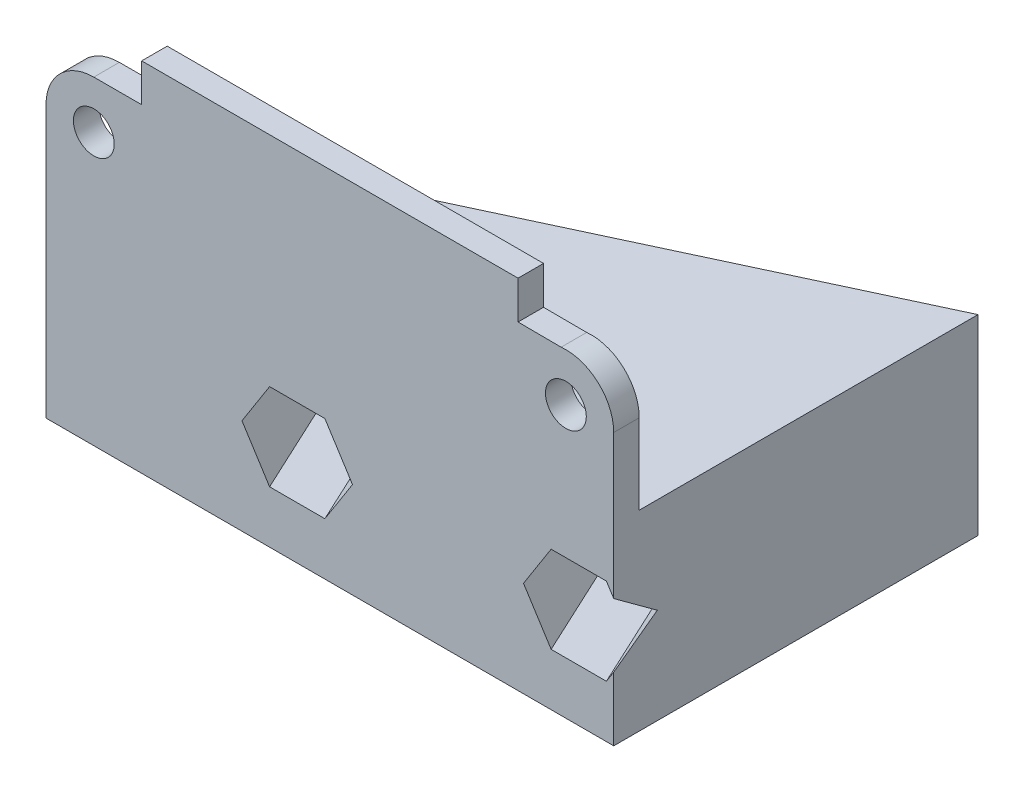
from build123d import *

# Parameters (mm, degrees)
SKETCH1_R           = 3.75
SKETCH1_R_2         = 1.6
BOSS_EXTRUDE1_DEPTH = 2
BOSS_EXTRUDE2_START = -15
BOSS_EXTRUDE2_DEPTH = 15
BOSS_EXTRUDE3_DEPTH = 2
SKETCH2_R           = 2
CUT_EXTRUDE1_DEPTH  = 39.169212171
CUT_EXTRUDE2_START  = -4
SKETCH2_3_R         = 2
CUT_EXTRUDE2_DEPTH  = 35.169212171


# Read off the part's stored shape, not the designer's step: Boss-Extrude2
with BuildPart() as part:
    # Sketch1 → Boss-Extrude1 (new body)
    # profile 1 of 5: a face of its own
    with BuildSketch(Plane.XY):
        with Locations((-33.25, 6.273123532)):
            Circle(SKETCH1_R)
        with Locations((-33.25, 6.273123532)):
            Circle(SKETCH1_R_2, mode=Mode.SUBTRACT)
    # profile 2 of 5: a face of its own
    with BuildSketch(Plane.XY):
        with BuildLine():
            Line((0, 2.523123532), (3.75, 2.523123532))
            ThreePointArc((3.75, 2.523123532), (0.004577287, 6.087897443), (3.38, 10.004825556))
            Line((3.38, 10.004825556), (0, 10.023123532))
            Line((0, 10.023123532), (0, 13))
            Line((0, 13), (-29.5, 13))
            Line((-29.5, 13), (-29.5, 10.023123532))
            Line((-29.5, 10.023123532), (-33.25, 10.023123532))
            ThreePointArc((-33.25, 10.023123532), (-30.598349571, 8.924773961), (-29.5, 6.273123532))
            ThreePointArc((-29.5, 6.273123532), (-30.598349571, 3.621473102), (-33.25, 2.523123532))
            Line((-33.25, 2.523123532), (-29.5, 2.523123532))
            Line((-29.5, 2.523123532), (-29.5, 0))
            Line((-29.5, 0), (0, 0))
            Line((0, 0), (0, 2.523123532))
        make_face()
    # profile 3 of 5: a face of its own
    with BuildSketch(Plane.XY):
        with Locations((3.75, 6.273123532)):
            Circle(SKETCH1_R)
        with Locations((3.75, 6.273123532)):
            Circle(SKETCH1_R_2, mode=Mode.SUBTRACT)
    # profile 4 of 5: a face of its own
    with BuildSketch(Plane.XY):
        with BuildLine():
            ThreePointArc((7.5, 6.273123532), (6.401650429, 3.621473102), (3.75, 2.523123532))
            Line((3.75, 2.523123532), (0, 2.523123532))
            Line((0, 2.523123532), (0, 0))
            Line((0, 0), (7.5, 0))
            Line((7.5, 0), (7.5, 6.273123532))
        make_face()
    # profile 5 of 5: a face of its own
    with BuildSketch(Plane.XY):
        with BuildLine():
            Line((-37, 0), (-29.5, 0))
            Line((-29.5, 0), (-29.5, 2.523123532))
            Line((-29.5, 2.523123532), (-33.25, 2.523123532))
            ThreePointArc((-33.25, 2.523123532), (-35.901650429, 3.621473102), (-37, 6.273123532))
            Line((-37, 6.273123532), (-37, 0))
        make_face()
    extrude(amount=BOSS_EXTRUDE1_DEPTH)



with BuildPart() as body_2:
    # Boss-Extrude2 outline → Boss-Extrude2 (new body)
    with BuildSketch(Plane(origin=(0, 0, 0), x_dir=(1, 0, 0), z_dir=(0, 1, 0)).offset(BOSS_EXTRUDE2_START)):
        Polygon((7.5, 0), (7.5, 26.552667029), (-37, 5.801976241), (-37, 0), align=None)
    extrude(amount=BOSS_EXTRUDE2_DEPTH)


with BuildPart() as part_1:
    add(part.part)

    add(body_2.part)  # Boss-Extrude3 merges body 2
    # Sketch1<5> → Boss-Extrude3 (add)
    with BuildSketch(Plane.XY):
        Polygon((7.5, 0), (0, 0), (-29.5, 0), (-37, 0), (-37, -15), (7.5, -15), align=None)
    extrude(amount=BOSS_EXTRUDE3_DEPTH)

    # Sketch2 → Cut-Extrude1 (cut, through all)
    with BuildSketch(Plane(origin=(-8.83071505, 0, -18.937529538), x_dir=(-0.9063077870366508, 0, 0.42261826174069766), z_dir=(-0.4226182617406977, 1.198406961524809e-15, -0.9063077870366509))):
        with Locations((16.531049613, -7.5)):
            Circle(SKETCH2_R)
        with Locations((-3.468950387, -7.5)):
            Circle(SKETCH2_R)
    extrude(amount=-CUT_EXTRUDE1_DEPTH, mode=Mode.SUBTRACT)

    # Sketch2<3> → Cut-Extrude2 (cut, through all)
    # profile 1 of 2: a face of its own
    with BuildSketch(Plane(origin=(-8.83071505, 0, -18.937529538), x_dir=(-0.9063077870366508, 0, 0.42261826174069766), z_dir=(-0.4226182617406977, 1.198406961524809e-15, -0.9063077870366509)).offset(CUT_EXTRUDE2_START)):
        Polygon((12.605067782, -7.5), (14.568058697, -10.9), (18.494040528, -10.9), (20.457031443, -7.5), (18.494040528, -4.1), (14.568058697, -4.1), align=None)
        with Locations((16.531049613, -7.5)):
            Circle(SKETCH2_3_R, mode=Mode.SUBTRACT)
    # profile 2 of 2: a face of its own
    with BuildSketch(Plane(origin=(-8.83071505, 0, -18.937529538), x_dir=(-0.9063077870366508, 0, 0.42261826174069766), z_dir=(-0.4226182617406977, 1.198406961524809e-15, -0.9063077870366509)).offset(CUT_EXTRUDE2_START)):
        Polygon((-5.431941303, -4.1), (-7.394932218, -7.5), (-5.431941303, -10.9), (-1.505959472, -10.9), (0.457031443, -7.5), (-1.505959472, -4.1), align=None)
        with Locations((-3.468950387, -7.5)):
            Circle(SKETCH2_3_R, mode=Mode.SUBTRACT)
    extrude(amount=-CUT_EXTRUDE2_DEPTH, mode=Mode.SUBTRACT)


solid = part_1.part
